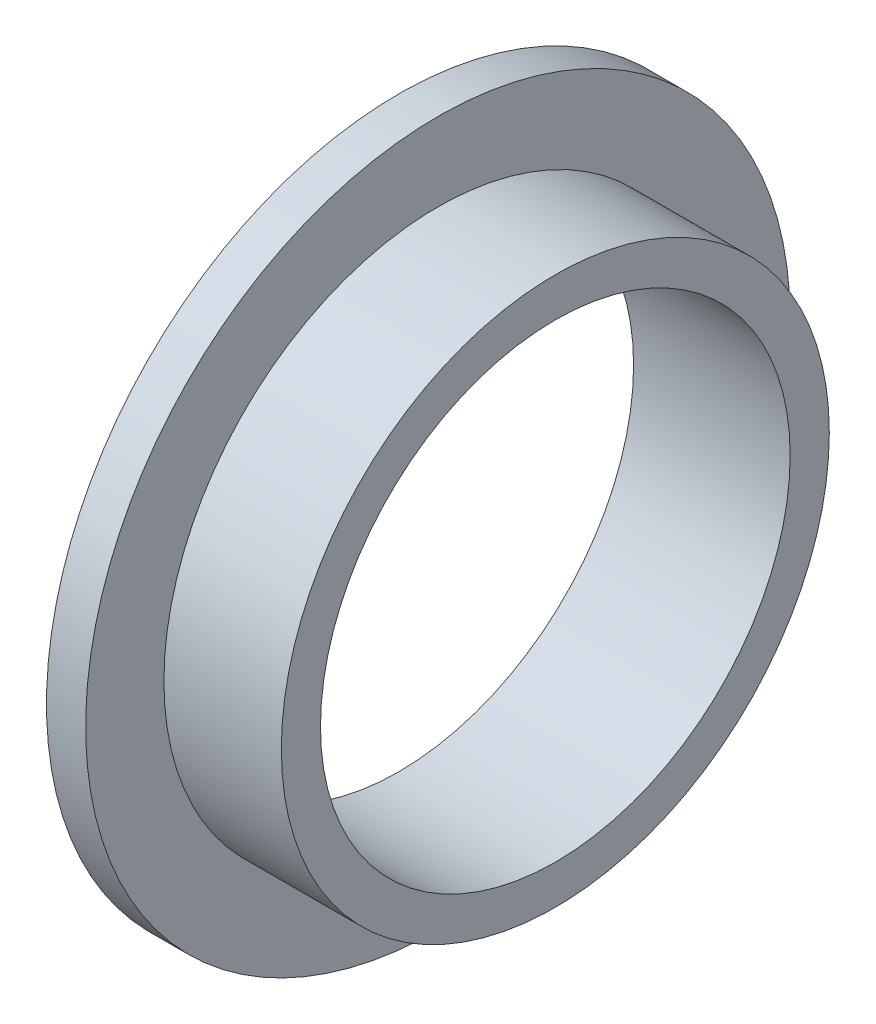
from build123d import *

# Parameters (mm, degrees)
SKETCH1_R           = 57.15
SKETCH1_R_2         = 38.1
BOSS_EXTRUDE1_DEPTH = 6.35
SKETCH2_R           = 44.45
SKETCH2_R_2         = 38.1
BOSS_EXTRUDE2_DEPTH = 19.05


with BuildPart() as part:
    # Sketch1 → Boss-Extrude1 (new body)
    with BuildSketch(Plane(origin=(0, 0, 0), x_dir=(0, 0, -1), z_dir=(1, 0, 0))):
        Circle(SKETCH1_R)
        Circle(SKETCH1_R_2, mode=Mode.SUBTRACT)
    extrude(amount=BOSS_EXTRUDE1_DEPTH)

    # Sketch2 → Boss-Extrude2 (add)
    with BuildSketch(Plane(origin=(6.35, 0, 0), x_dir=(0, 0, -1), z_dir=(1, 0, 0))):
        Circle(SKETCH2_R)
        Circle(SKETCH2_R_2, mode=Mode.SUBTRACT)
    extrude(amount=BOSS_EXTRUDE2_DEPTH)


solid = part.part
